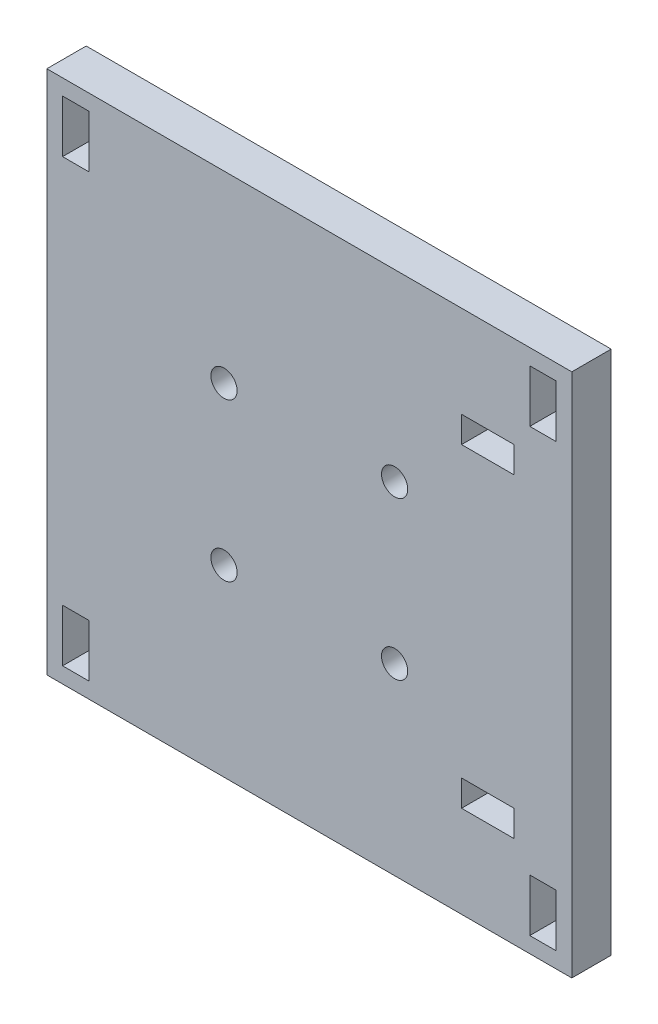
from build123d import *

# Parameters (mm, degrees)
SKETCH1_W           = 40
SKETCH1_H           = 40
SKETCH1_R           = 1
BOSS_EXTRUDE1_DEPTH = 3
SKETCH2_W           = 2
SKETCH2_H           = 4
SKETCH2_W_2         = 4
SKETCH2_H_2         = 2
CUT_EXTRUDE1_DEPTH  = 29.442925307


with BuildPart() as part:
    # Sketch1 → Boss-Extrude1 (new body)
    with BuildSketch(Plane.XY):
        Rectangle(SKETCH1_W, SKETCH1_H)
        with Locations((6.5, -6)):
            Circle(SKETCH1_R, mode=Mode.SUBTRACT)
        with Locations((-6.5, -6)):
            Circle(SKETCH1_R, mode=Mode.SUBTRACT)
        with Locations((6.5, 6)):
            Circle(SKETCH1_R, mode=Mode.SUBTRACT)
        with Locations((-6.5, 6)):
            Circle(SKETCH1_R, mode=Mode.SUBTRACT)
    extrude(amount=BOSS_EXTRUDE1_DEPTH)

    # Sketch2 → Cut-Extrude1 (cut, through all)
    with BuildSketch(Plane.XY.offset(3)):
        with Locations((17.8, 16.8)):
            Rectangle(SKETCH2_W, SKETCH2_H)
        with Locations((-17.8, 16.8)):
            Rectangle(SKETCH2_W, SKETCH2_H)
        with Locations((13.6, 12)):
            Rectangle(SKETCH2_W_2, SKETCH2_H_2)
        with Locations((17.8, -16.8)):
            Rectangle(SKETCH2_W, SKETCH2_H)
        with Locations((-17.8, -16.8)):
            Rectangle(SKETCH2_W, SKETCH2_H)
        with Locations((13.6, -12)):
            Rectangle(SKETCH2_W_2, SKETCH2_H_2)
    extrude(amount=-CUT_EXTRUDE1_DEPTH, mode=Mode.SUBTRACT)


solid = part.part
